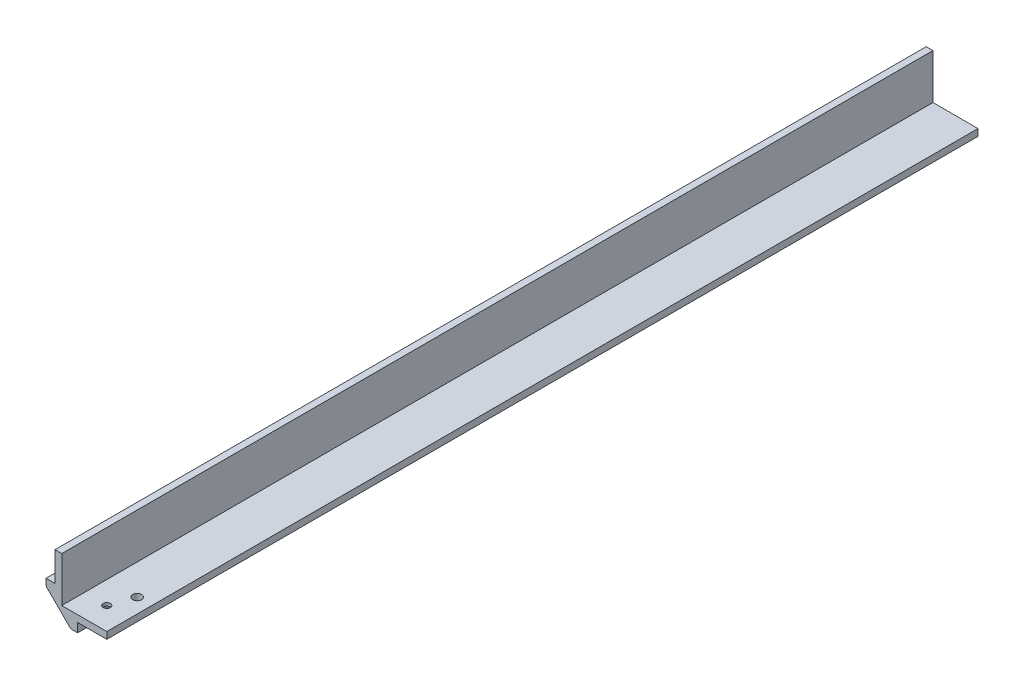
from build123d import *

# Parameters (mm, degrees)
BOSS_EXTRUDE1_DEPTH             = 386.9
CBORE_FOR_M3_SBHCS1_D           = 3.2
CBORE_FOR_M3_SBHCS1_CBORE_D     = 6
CBORE_FOR_M3_SBHCS1_CBORE_DEPTH = 1.65
SKETCH4_R                       = 2
CUT_EXTRUDE1_DEPTH              = 10
FILLET1_R                       = 1.5


with BuildPart() as part:
    # Sketch1 → Boss-Extrude1 (new body)
    with BuildSketch(Plane.XY.offset(280)):
        Polygon((-7, 4), (4, -7), (7, -7), (7, -3), (20, -3), (20, 0), (0, 0), (0, 20), (-3, 20), (-3, 7), (-7, 7), align=None)
    extrude(amount=-BOSS_EXTRUDE1_DEPTH)

    # CBORE for M3 SBHCS1 (through all)
    with Locations(Plane.XZ.offset(3)):
        with Locations((10, 270)):
            CounterBoreHole(CBORE_FOR_M3_SBHCS1_D / 2, CBORE_FOR_M3_SBHCS1_CBORE_D / 2, CBORE_FOR_M3_SBHCS1_CBORE_DEPTH)

    # Sketch4 → Cut-Extrude1 (cut)
    with BuildSketch(Plane.XZ.offset(3)):
        with Locations((13.5, 260)):
            Circle(SKETCH4_R)
    extrude(amount=-CUT_EXTRUDE1_DEPTH, mode=Mode.SUBTRACT)

    # Fillet1
    fillet1_edges = [part.edges().sort_by_distance(p)[0] for p in [
        (-7, 4, 86.55),
        (4, -7, 86.55),
    ]]
    fillet(fillet1_edges, radius=FILLET1_R)


solid = part.part
